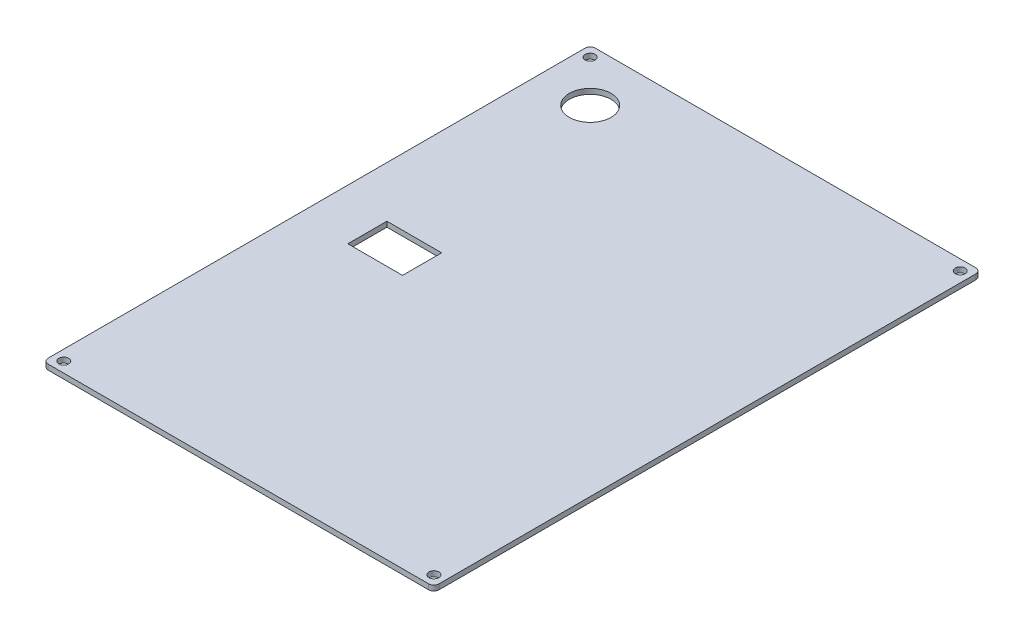
from build123d import *

# Parameters (mm, degrees)
SKETCH1_W           = 150
SKETCH1_H           = 210
BOSS_EXTRUDE1_DEPTH = 2
SKETCH2_R           = 1.9
SKETCH2_R_2         = 8
CUT_EXTRUDE1_DEPTH  = 10
FILLET1_R           = 2
SKETCH3_W           = 21
SKETCH3_H           = 15
CUT_EXTRUDE2_DEPTH  = 10


with BuildPart() as part:
    # Sketch1 → Boss-Extrude1 (new body)
    with BuildSketch(Plane(origin=(0, 0, 0), x_dir=(1, 0, 0), z_dir=(0, 1, 0))):
        with Locations((75, 105)):
            Rectangle(SKETCH1_W, SKETCH1_H)
    extrude(amount=BOSS_EXTRUDE1_DEPTH)

    # Sketch2 → Cut-Extrude1 (cut)
    with BuildSketch(Plane(origin=(0, 2, 0), x_dir=(1, 0, 0), z_dir=(0, 1, 0))):
        with Locations((4, 206)):
            Circle(SKETCH2_R)
        with Locations((146, 206)):
            Circle(SKETCH2_R)
        with Locations((146, 4)):
            Circle(SKETCH2_R)
        with Locations((4, 4)):
            Circle(SKETCH2_R)
        with Locations((20, 190)):
            Circle(SKETCH2_R_2)
    extrude(amount=-CUT_EXTRUDE1_DEPTH, mode=Mode.SUBTRACT)

    # Fillet1
    fillet1_edges = [part.edges().sort_by_distance(p)[0] for p in [
        (0, 1, 0),
        (150, 1, 0),
        (150, 1, -210),
        (0, 1, -210),
    ]]
    fillet(fillet1_edges, radius=FILLET1_R)

    # Sketch3 → Cut-Extrude2 (cut)
    with BuildSketch(Plane(origin=(0, 2, 0), x_dir=(1, 0, 0), z_dir=(0, 1, 0))):
        with Locations((30, 105)):
            Rectangle(SKETCH3_W, SKETCH3_H)
    extrude(amount=-CUT_EXTRUDE2_DEPTH, mode=Mode.SUBTRACT)


solid = part.part
